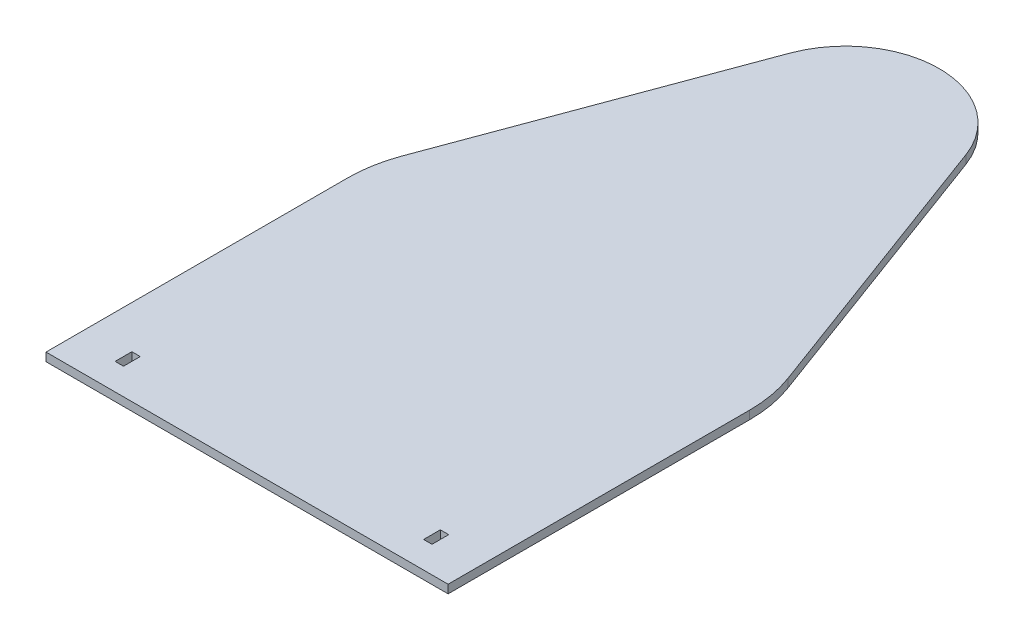
from build123d import *

# Parameters (mm, degrees)
SKETCH3_W           = 3.175
SKETCH3_H           = 6.35
BOSS_EXTRUDE1_DEPTH = 3.175


with BuildPart() as part:
    # Sketch3 → Boss-Extrude1 (new body)
    with BuildSketch(Plane(origin=(0, 0, 0), x_dir=(1, 0, 0), z_dir=(0, 1, 0))):
        with BuildLine():
            Line((0, 0), (0, 114.3))
            ThreePointArc((0, 114.3), (0.796571799, 123.260868714), (3.161305831, 131.940714778))
            Line((3.161305831, 131.940714778), (42.852914082, 239.127776658))
            ThreePointArc((42.852914082, 239.127776658), (76.2, 262.339276313), (109.547085918, 239.127776658))
            Line((109.547085918, 239.127776658), (149.238694169, 131.940714778))
            ThreePointArc((149.238694169, 131.940714778), (151.603428201, 123.260868714), (152.4, 114.3))
            Line((152.4, 114.3), (152.4, 0))
            Line((152.4, 0), (0, 0))
        make_face()
        with Locations((17.742549096, 13.212735966)):
            Rectangle(SKETCH3_W, SKETCH3_H, mode=Mode.SUBTRACT)
        with Locations((134.657450904, 13.212735966)):
            Rectangle(SKETCH3_W, SKETCH3_H, mode=Mode.SUBTRACT)
    extrude(amount=BOSS_EXTRUDE1_DEPTH)


solid = part.part
